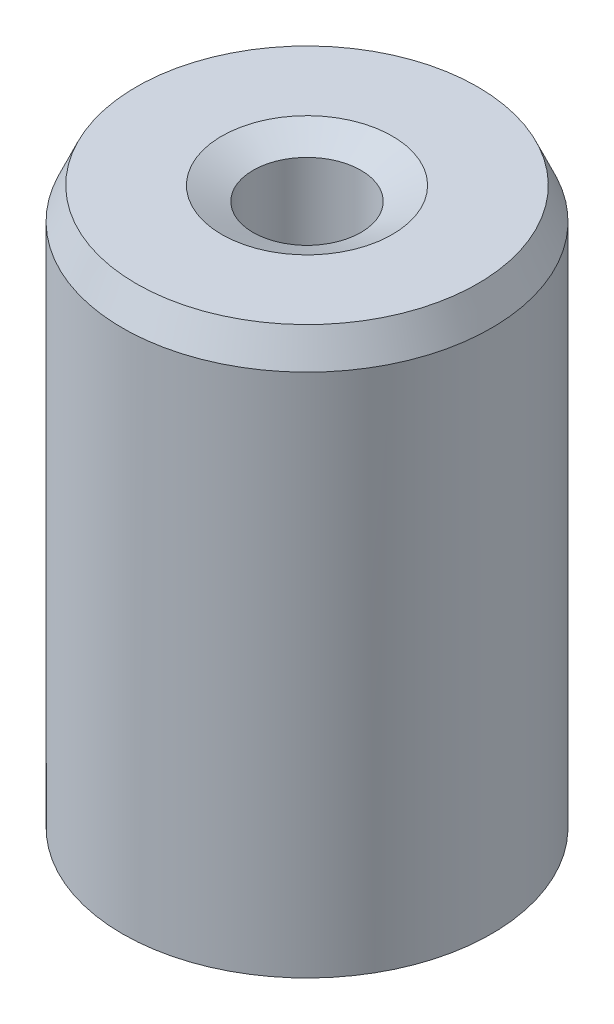
from build123d import *
from OCP.BRepFilletAPI import BRepFilletAPI_MakeChamfer

# Parameters (mm, degrees)
SKETCH1_R           = 5
BOSS_EXTRUDE1_DEPTH = 15.442019023
SKETCH2_R           = 1.460549317
CUT_EXTRUDE1_DEPTH  = 17.983991036
CHAMFER1_SIZE       = 0.84996482
CHAMFER1_SIZE2      = 0.377486933


with BuildPart() as part:
    # Sketch1 → Boss-Extrude1 (new body)
    with BuildSketch(Plane(origin=(0, 0, 0), x_dir=(1, 0, 0), z_dir=(0, 1, 0))):
        Circle(SKETCH1_R)
    extrude(amount=BOSS_EXTRUDE1_DEPTH)

    # Sketch2 → Cut-Extrude1 (cut, through all)
    with BuildSketch(Plane(origin=(0, 0, 0), x_dir=(1, 0, 0), z_dir=(0, 1, 0))):
        Circle(SKETCH2_R)
    extrude(amount=CUT_EXTRUDE1_DEPTH, mode=Mode.SUBTRACT)

    # Chamfer1: one chamfer whose edges measure the first distance from different faces: ONE call of the kernel's chamfer builder (chamfer() names one face for all edges)
    chamfer1_edges_1 = [part.edges().sort_by_distance(p)[0] for p in [
        (-1.460549317, 15.442019023, 0),
    ]]
    chamfer1_side_1 = [part.faces().sort_by_distance(p)[0] for p in [
        (-4.858578644, 15.442019023, 0),
    ]]
    chamfer1_edges_2 = [part.edges().sort_by_distance(p)[0] for p in [
        (-1.460549317, 0, 0),
    ]]
    chamfer1_side_2 = [part.faces().sort_by_distance(p)[0] for p in [
        (-1.460549317, 7.721009511, 0),
    ]]
    chamfer1_edges_3 = [part.edges().sort_by_distance(p)[0] for p in [
        (-5, 0, 0),
    ]]
    chamfer1_side_3 = [part.faces().sort_by_distance(p)[0] for p in [
        (-4.858578644, 0, 0),
    ]]
    chamfer1_edges_4 = [part.edges().sort_by_distance(p)[0] for p in [
        (-5, 15.442019023, 0),
    ]]
    chamfer1_side_4 = [part.faces().sort_by_distance(p)[0] for p in [
        (-5, 7.721009511, 0),
    ]]
    chamfer1 = BRepFilletAPI_MakeChamfer(part.part.solid().wrapped)
    for e in chamfer1_edges_1:
        chamfer1.Add(CHAMFER1_SIZE, CHAMFER1_SIZE2, e.wrapped, chamfer1_side_1[0].wrapped)  # the first distance lies on this face
    for e in chamfer1_edges_2:
        chamfer1.Add(CHAMFER1_SIZE, CHAMFER1_SIZE2, e.wrapped, chamfer1_side_2[0].wrapped)  # the first distance lies on this face
    for e in chamfer1_edges_3:
        chamfer1.Add(CHAMFER1_SIZE, CHAMFER1_SIZE2, e.wrapped, chamfer1_side_3[0].wrapped)  # the first distance lies on this face
    for e in chamfer1_edges_4:
        chamfer1.Add(CHAMFER1_SIZE, CHAMFER1_SIZE2, e.wrapped, chamfer1_side_4[0].wrapped)  # the first distance lies on this face
    add(Compound.cast(chamfer1.Shape()), mode=Mode.REPLACE)


solid = part.part
